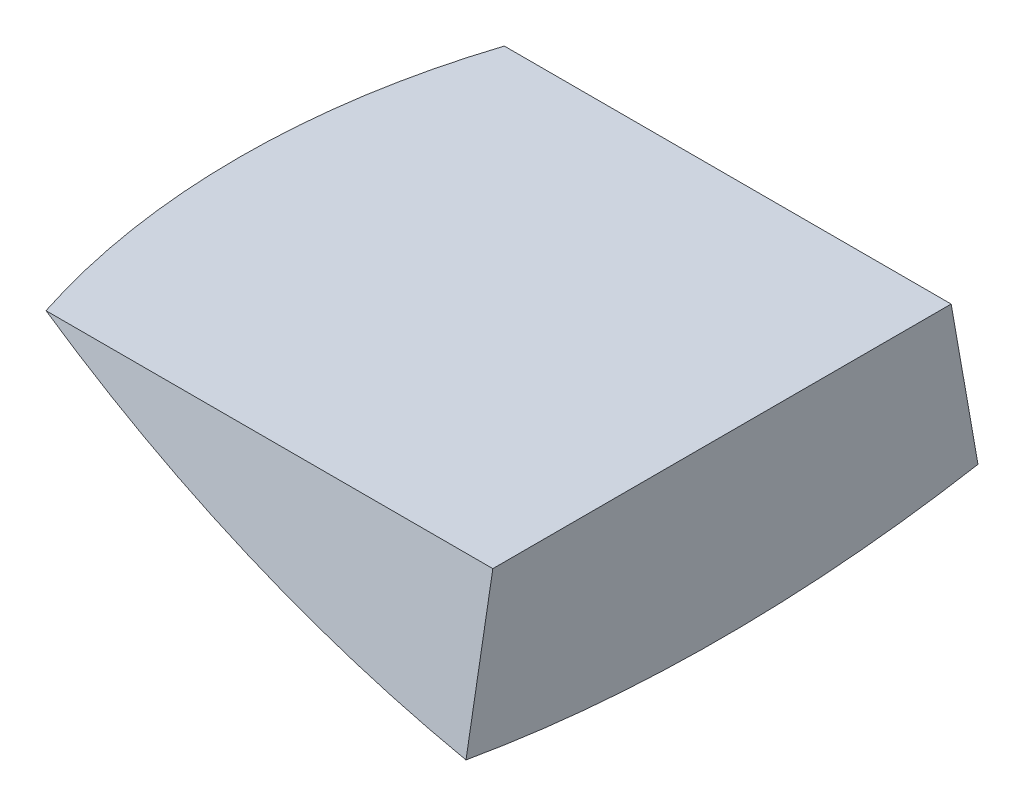
from build123d import *

# Parameters (mm, degrees)
REVOLVE1_ANGLE     = 20
SKETCH2_W          = 414.694447971
SKETCH2_H          = 155.943368172
CUT_EXTRUDE1_DEPTH = 808.186024073


with BuildPart() as part:
    # Sketch1 → Revolve1 (revolve, symmetric)
    with BuildSketch(Plane.XY) as revolve1_sk:
        with BuildLine():
            Line((-132.319911382, -750.423507795), (-132.319911382, -648.823507795))
            Line((-132.319911382, -648.823507795), (-399.589859396, -648.823507795))
            ThreePointArc((-399.589859396, -648.823507795), (-270.763071822, -712.271969782), (-132.319911382, -750.423507795))
        make_face()
    revolve(axis=Axis((0, 0, 0), (-1, 0, 0)), revolution_arc=REVOLVE1_ANGLE / 2)
    revolve(revolve1_sk.sketch, axis=Axis((0, 0, 0), (1, 0, 0)), revolution_arc=REVOLVE1_ANGLE / 2)

    # Sketch2 → Cut-Extrude1 (cut, through all)
    with BuildSketch(Plane(origin=(-132.319911382, 0, 0), x_dir=(0, 0, -1), z_dir=(1, 0, 0))):
        with Locations((-9.950026192, -583.551823709)):
            Rectangle(SKETCH2_W, SKETCH2_H)
    extrude(amount=-CUT_EXTRUDE1_DEPTH, mode=Mode.SUBTRACT)


solid = part.part
